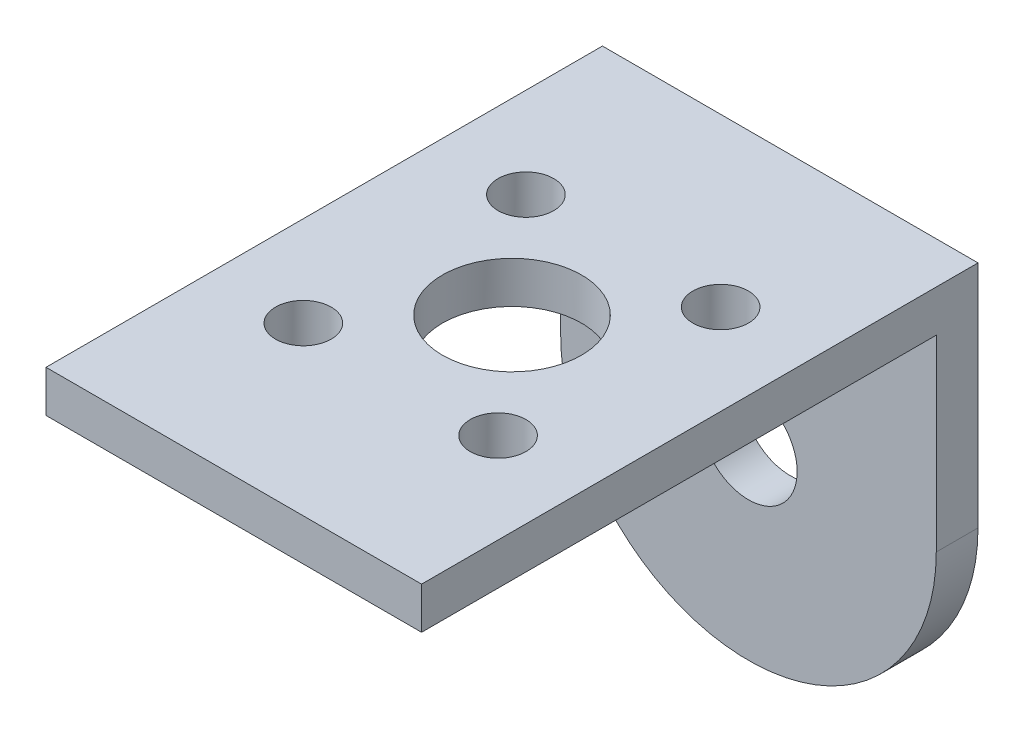
from build123d import *

# Parameters (mm, degrees)
MODEL_R             = 3.5
EXTRUDE_1_DEPTH     = 40
SKETCH_3_W          = 37
SKETCH_3_H          = 37
CUT_EXTRUDE_1_DEPTH = 40
SKETCH_4_R          = 2
CUT_EXTRUDE_2_DEPTH = 40
SKETCH2_R           = 5
CUT_EXTRUDE1_DEPTH  = 10


with BuildPart() as part:
    # Model → 凸台-拉伸1 (new body)
    with BuildSketch(Plane.XY):
        with BuildLine():
            Line((2619.766714505, 1592.826425633), (2619.766714505, 1609.326425633))
            Line((2619.766714505, 1609.326425633), (2592.766714505, 1609.326425633))
            Line((2592.766714505, 1609.326425633), (2592.766714505, 1592.826425633))
            ThreePointArc((2592.766714505, 1592.826425633), (2606.266714505, 1579.326425633), (2619.766714505, 1592.826425633))
        make_face()
        with Locations((2606.266714505, 1592.826425633)):
            Circle(MODEL_R, mode=Mode.SUBTRACT)
    extrude(amount=EXTRUDE_1_DEPTH)

    # 草图3 → 切除-拉伸1 (cut)
    with BuildSketch(Plane(origin=(2619.766714505, 0, 0), x_dir=(0, 0, -1), z_dir=(1, 0, 0))):
        with Locations((-21.5, 1587.826425633)):
            Rectangle(SKETCH_3_W, SKETCH_3_H)
    extrude(amount=-CUT_EXTRUDE_1_DEPTH, mode=Mode.SUBTRACT)

    # 草图4 → 切除-拉伸2 (cut)
    with BuildSketch(Plane(origin=(0, 1609.326425633, 0), x_dir=(1, 0, 0), z_dir=(0, 1, 0))):
        with Locations((2599.266714505, -28)):
            Circle(SKETCH_4_R)
        with Locations((2613.266714505, -28)):
            Circle(SKETCH_4_R)
        with Locations((2599.266714505, -12)):
            Circle(SKETCH_4_R)
        with Locations((2613.266714505, -12)):
            Circle(SKETCH_4_R)
    extrude(amount=-CUT_EXTRUDE_2_DEPTH, mode=Mode.SUBTRACT)

    # Sketch2 → Cut-Extrude1 (cut)
    with BuildSketch(Plane(origin=(0, 1609.326425633, 0), x_dir=(1, 0, 0), z_dir=(0, 1, 0))):
        with Locations((2606.266714505, -20)):
            Circle(SKETCH2_R)
    extrude(amount=-CUT_EXTRUDE1_DEPTH, mode=Mode.SUBTRACT)


solid = part.part
